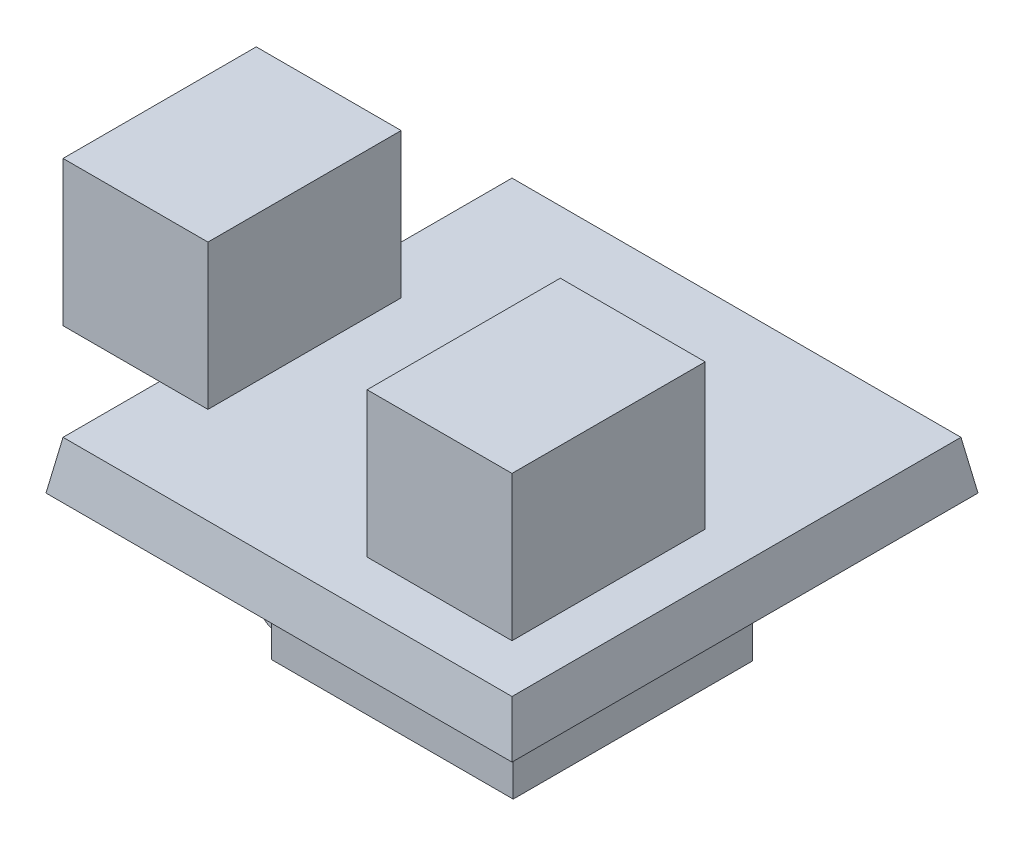
from build123d import *

# Parameters (mm, degrees)
SKETCH1_W                = 100
SKETCH1_H                = 100
BOSS_EXTRUDE1_DEPTH      = 20
BOSS_EXTRUDE1_TAPER      = 10
BOSS_EXTRUDE2_DEPTH      = 20
BOSS_EXTRUDE2_DEPTH_BACK = 10
BOSS_EXTRUDE2_START      = 30
SKETCH2_W                = 30
SKETCH2_H                = 40
BOSS_EXTRUDE3_START      = 10
SKETCH3_W                = 30
SKETCH3_H                = 40
BOSS_EXTRUDE3_DEPTH      = 30
SKETCH5_R                = 15
CUT_EXTRUDE1_DEPTH       = 30
SKETCH7_OUTSIDE_W        = 135.526
SKETCH7_OUTSIDE_H        = 135.526
CUT_EXTRUDE2_DEPTH       = 30


with BuildPart() as part:
    # Sketch1 → Boss-Extrude1 (new body)
    with BuildSketch(Plane(origin=(0, 0, 0), x_dir=(1, 0, 0), z_dir=(0, 1, 0))):
        Rectangle(SKETCH1_W, SKETCH1_H)
    boss_extrude1 = extrude(amount=BOSS_EXTRUDE1_DEPTH, taper=BOSS_EXTRUDE1_TAPER)

    # Sketch5 → Cut-Extrude1 (cut)
    with BuildSketch(Plane(origin=(0, 20, 0), x_dir=(1, 0, 0), z_dir=(0, 1, 0))):
        Circle(SKETCH5_R)
    extrude(amount=-CUT_EXTRUDE1_DEPTH, mode=Mode.SUBTRACT)

    # Mirror3: Boss-Extrude1 across plane
    add(boss_extrude1.mirror(Plane.ZX))

    # Sketch7 outside → Cut-Extrude2 (cut)
    with BuildSketch(Plane.XZ.offset(20)):
        Rectangle(SKETCH7_OUTSIDE_W, SKETCH7_OUTSIDE_H)
        with BuildLine():
            Line((25, 24.751616122), (-25, 24.751616122))
            Line((-25, 24.751616122), (-25, 20))
            ThreePointArc((-25, 20), (-45, 0), (-25, -20))
            Line((-25, -20), (-25, -24.751616122))
            Line((-25, -24.751616122), (25, -24.751616122))
            Line((25, -24.751616122), (25, 24.751616122))
        make_face(mode=Mode.SUBTRACT)
    extrude(amount=-CUT_EXTRUDE2_DEPTH, mode=Mode.SUBTRACT)


with BuildPart() as body_2:
    # Sketch2 → Boss-Extrude2 (new, two sides: drawn at the far end of the back side and taken through both)
    with BuildSketch(Plane(origin=(0, 20, 0), x_dir=(1, 0, 0), z_dir=(0, 1, 0)).offset(BOSS_EXTRUDE2_START - BOSS_EXTRUDE2_DEPTH_BACK)):
        with Locations((-31.473460386, -26.473460386)):
            Rectangle(SKETCH2_W, SKETCH2_H)
    extrude(amount=BOSS_EXTRUDE2_DEPTH + BOSS_EXTRUDE2_DEPTH_BACK)


with BuildPart() as body_3:
    # Sketch3 → Boss-Extrude3 (new body)
    with BuildSketch(Plane(origin=(0, 20, 0), x_dir=(1, 0, 0), z_dir=(0, 1, 0)).offset(BOSS_EXTRUDE3_START)):
        with Locations((31.473460386, -26.473460386)):
            Rectangle(SKETCH3_W, SKETCH3_H)
    extrude(amount=BOSS_EXTRUDE3_DEPTH)


solid = Compound([part.part, body_2.part, body_3.part])
